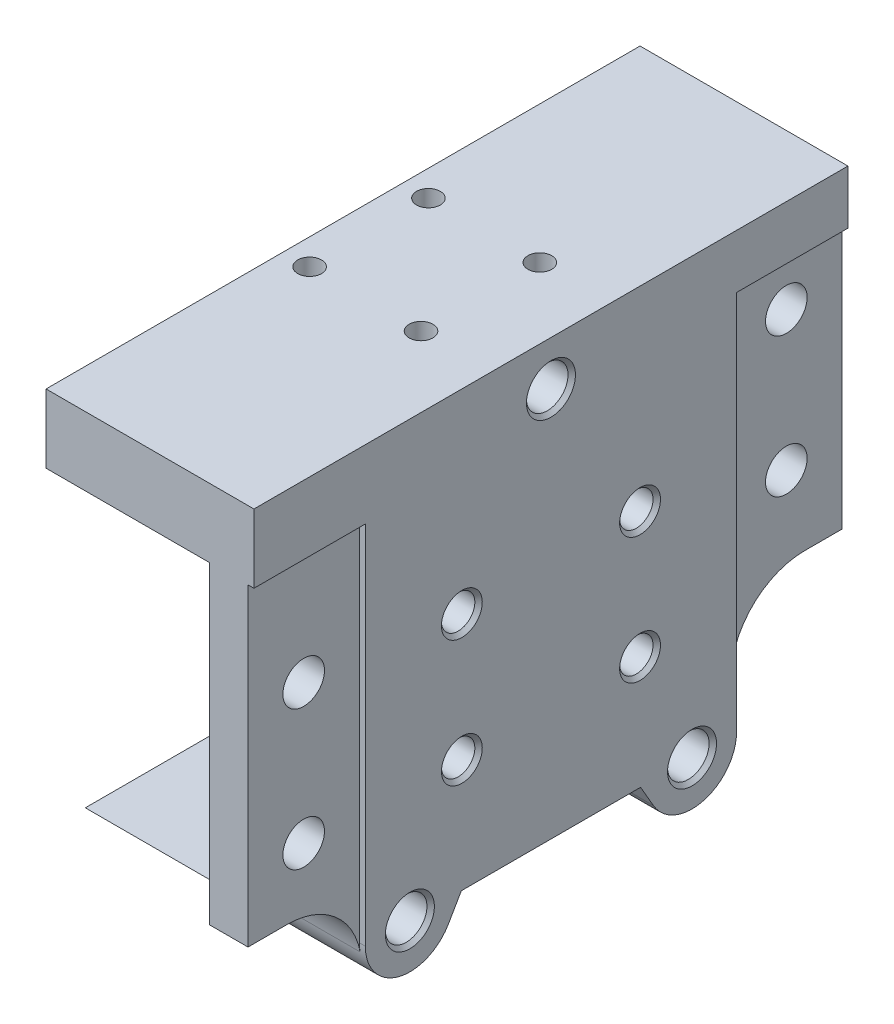
from build123d import *

# Parameters (mm, degrees)
BOSS_EXTRUDE1_DEPTH        = 50
F_3_2_3_2_DIAMETER_HOLE1_D = 3.2
SKETCH5_R                  = 2.25
CUT_EXTRUDE1_DEPTH         = 79.74007874
SKETCH6_W                  = 15
SKETCH6_H                  = 4.75
BOSS_EXTRUDE2_DEPTH        = 28
SKETCH8_W                  = 12.2
SKETCH8_H                  = 80
BOSS_EXTRUDE3_DEPTH        = 25
SKETCH9_R                  = 2.75
CUT_EXTRUDE2_DEPTH         = 105.770033884
BOSS_EXTRUDE4_REACH        = 108.066
CUT_EXTRUDE3_REACH         = 108.066
SKETCH11_R                 = 2.8
CHAMFER1_SIZE              = 0.5
CUT_EXTRUDE4_DEPTH         = 104.806358187
SKETCH14_W                 = 15
SKETCH14_H                 = 40
BOSS_EXTRUDE5_DEPTH        = 5.2
SKETCH16_W                 = 15
SKETCH16_H                 = 17
CUT_EXTRUDE6_DEPTH         = 92.821838361
SKETCH18_W                 = 15
SKETCH18_H                 = 35.5
BOSS_EXTRUDE6_DEPTH        = 5.2
SKETCH20_W                 = 7.799038106
SKETCH20_H                 = 4.25
BOSS_EXTRUDE7_DEPTH        = 27.2
FILLET1_R                  = 10
SKETCH22_R                 = 2.8
CUT_EXTRUDE8_DEPTH         = 92.581056993
SKETCH24_R                 = 2.8
CUT_EXTRUDE9_DEPTH         = 91.173443984
BOSS_EXTRUDE9_START        = -28
BOSS_EXTRUDE9_DEPTH        = 28
CUT_EXTRUDE11_START        = 10
SKETCH29_R                 = 3.75
SKETCH29_R_2               = 1.6
CUT_EXTRUDE11_DEPTH        = 10
SKETCH28_W                 = 15
SKETCH28_H                 = 2.25
BOSS_EXTRUDE10_DEPTH       = 5.2
SKETCH30_W                 = 7.799038106
SKETCH30_H                 = 4.5
BOSS_EXTRUDE11_DEPTH       = 28
SKETCH31_W                 = 15
SKETCH31_H                 = 7.25
BOSS_EXTRUDE12_DEPTH       = 28
BOSS_EXTRUDE14_DEPTH       = 28
SKETCH33_R                 = 1.6
CUT_EXTRUDE12_DEPTH        = 86.574528921


with BuildPart() as part:
    # Sketch1 → Boss-Extrude1 (new body)
    with BuildSketch(Plane.XY):
        Polygon((-11, 0), (17, 0), (17, 54), (-11, 54), (-11, 47), (11, 47), (11, 7), (-11, 7), align=None)
    extrude(amount=BOSS_EXTRUDE1_DEPTH)

    # Ø3.2 (3.2) Diameter Hole1 (through all)
    with Locations(Plane(origin=(0, 0, 0), x_dir=(-1, 0, 0), z_dir=(0, -1, 0))):
        with Locations((-7.5, -17), (7.5, -17), (7.5, -33), (-7.5, -33)):
            Hole(F_3_2_3_2_DIAMETER_HOLE1_D / 2)

    # Sketch5 → Cut-Extrude1 (cut, through all)
    with BuildSketch(Plane(origin=(17, 0, 0), x_dir=(0, 0, -1), z_dir=(1, 0, 0))):
        with Locations(Location((-37, 32.25, 0), (0, 0, 90))):
            Circle(SKETCH5_R)
        with Locations(Location((-13, 32.25, 0), (0, 0, 90))):
            Circle(SKETCH5_R)
        with Locations(Location((-37, 15.25, 0), (0, 0, 90))):
            Circle(SKETCH5_R)
        with Locations(Location((-13, 15.25, 0), (0, 0, 90))):
            Circle(SKETCH5_R)
    extrude(amount=-CUT_EXTRUDE1_DEPTH, mode=Mode.SUBTRACT)

    # Sketch6 → Boss-Extrude2 (add)
    with BuildSketch(Plane(origin=(17, 0, 0), x_dir=(0, 0, -1), z_dir=(1, 0, 0))):
        with Locations((-57.5, 51.625)):
            Rectangle(SKETCH6_W, SKETCH6_H)
        with Locations((7.5, 51.625)):
            Rectangle(SKETCH6_W, SKETCH6_H)
    extrude(amount=-BOSS_EXTRUDE2_DEPTH)

    # Sketch8 → Boss-Extrude3 (add)
    with BuildSketch(Plane(origin=(0, 54, 0), x_dir=(1, 0, 0), z_dir=(0, 1, 0))):
        with Locations((0.5, -25)):
            Rectangle(SKETCH8_W, SKETCH8_H)
    extrude(amount=BOSS_EXTRUDE3_DEPTH)

    # Sketch9 → Cut-Extrude2 (cut, through all)
    with BuildSketch(Plane.ZY.offset(5.6)):
        with Locations((-7.5, 66.2)):
            Circle(SKETCH9_R)
        with Locations((57.5, 66.2)):
            Circle(SKETCH9_R)
    extrude(amount=-CUT_EXTRUDE2_DEPTH, mode=Mode.SUBTRACT)

    # Boss-Extrude4: up to this face of the body (flat: up to its plane)
    boss_extrude4_end = Plane(part.part.faces().sort_by_distance((17, 28.337162775, 25))[0])
    # Sketch10 → Boss-Extrude4 (add, up to the picked face)
    with BuildSketch(Plane.ZY.offset(11), mode=Mode.PRIVATE) as boss_extrude4_sk1:
        with BuildLine():
            Line((11.196152423, -3), (12.92820323, 0))
            Line((12.92820323, 0), (0, 0))
            ThreePointArc((0, 0), (4.447085729, -5.795554958), (11.196152423, -3))
        make_face()
    boss_extrude4_tool1 = split(extrude(boss_extrude4_sk1.sketch, amount=-BOSS_EXTRUDE4_REACH, mode=Mode.PRIVATE), bisect_by=boss_extrude4_end, keep=Keep.BOTH, mode=Mode.PRIVATE)
    # Sketch10 → Boss-Extrude4 (add, up to the picked face)
    with BuildSketch(Plane.ZY.offset(11), mode=Mode.PRIVATE) as boss_extrude4_sk2:
        with BuildLine():
            Line((22, 57.696152423), (15.598076211, 54))
            Line((15.598076211, 54), (34.401923789, 54))
            Line((34.401923789, 54), (28, 57.696152423))
            ThreePointArc((28, 57.696152423), (25, 58.5), (22, 57.696152423))
        make_face()
    boss_extrude4_tool2 = split(extrude(boss_extrude4_sk2.sketch, amount=-BOSS_EXTRUDE4_REACH, mode=Mode.PRIVATE), bisect_by=boss_extrude4_end, keep=Keep.BOTH, mode=Mode.PRIVATE)
    # Sketch10 → Boss-Extrude4 (add, up to the picked face)
    with BuildSketch(Plane.ZY.offset(11), mode=Mode.PRIVATE) as boss_extrude4_sk3:
        with BuildLine():
            Line((38.803847577, -3), (37.07179677, 0))
            Line((37.07179677, 0), (50, 0))
            ThreePointArc((50, 0), (45.552914271, -5.795554958), (38.803847577, -3))
        make_face()
    boss_extrude4_tool3 = split(extrude(boss_extrude4_sk3.sketch, amount=-BOSS_EXTRUDE4_REACH, mode=Mode.PRIVATE), bisect_by=boss_extrude4_end, keep=Keep.BOTH, mode=Mode.PRIVATE)
    add(boss_extrude4_tool1.solids().sort_by(Axis((-11, -2.516615, 6.104318), (1, 0, 0)))[0])
    add(boss_extrude4_tool2.solids().sort_by(Axis((-11, 55.695428, 25), (1, 0, 0)))[0])
    add(boss_extrude4_tool3.solids().sort_by(Axis((-11, -2.516615, 43.895682), (1, 0, 0)))[0])

    # Sketch11 → Cut-Extrude3 (cut, up to next)
    with BuildSketch(Plane.ZY.offset(11), mode=Mode.PRIVATE) as cut_extrude3_sk1:
        with Locations(Location((25, 52.5, 0), (0, 0, 270))):
            Circle(SKETCH11_R)
    cut_extrude3_tool1 = extrude(cut_extrude3_sk1.sketch, amount=-CUT_EXTRUDE3_REACH, mode=Mode.PRIVATE) & part.part
    # Sketch11 → Cut-Extrude3 (cut, up to next)
    with BuildSketch(Plane.ZY.offset(11), mode=Mode.PRIVATE) as cut_extrude3_sk2:
        with Locations(Location((44, 0, 0), (0, 0, 270))):
            Circle(SKETCH11_R)
    cut_extrude3_tool2 = extrude(cut_extrude3_sk2.sketch, amount=-CUT_EXTRUDE3_REACH, mode=Mode.PRIVATE) & part.part
    # Sketch11 → Cut-Extrude3 (cut, up to next)
    with BuildSketch(Plane.ZY.offset(11), mode=Mode.PRIVATE) as cut_extrude3_sk3:
        with Locations(Location((6, 0, 0), (0, 0, 270))):
            Circle(SKETCH11_R)
    cut_extrude3_tool3 = extrude(cut_extrude3_sk3.sketch, amount=-CUT_EXTRUDE3_REACH, mode=Mode.PRIVATE) & part.part
    add(cut_extrude3_tool1.solids().sort_by_distance((-11, 52.5, 25))[0], mode=Mode.SUBTRACT)
    add(cut_extrude3_tool2.solids().sort_by_distance((-11, 0, 44))[0], mode=Mode.SUBTRACT)
    add(cut_extrude3_tool3.solids().sort_by_distance((-11, 0, 6))[0], mode=Mode.SUBTRACT)

    # Chamfer1
    chamfer1_edges = [part.edges().sort_by_distance(p)[0] for p in [
        (6.6, 66.2, -10.25),
        (-5.6, 66.2, -10.25),
        (6.6, 66.2, 54.75),
        (-5.6, 66.2, 54.75),
        (-11, 55.3, 25),
        (17, 55.3, 25),
        (-11, 2.8, 44),
        (17, 2.8, 44),
        (-11, 2.8, 6),
        (17, 2.8, 6),
        (11, 30, 13),
        (17, 30, 13),
        (11, 13, 37),
        (17, 13, 37),
        (11, 13, 13),
        (17, 13, 13),
        (11, 30, 37),
        (17, 30, 37),
    ]]
    chamfer(chamfer1_edges, length=CHAMFER1_SIZE)

    # Sketch12 → Cut-Extrude4 (cut, through all)
    with BuildSketch(Plane(origin=(6.6, 0, 0), x_dir=(0, 0, -1), z_dir=(1, 0, 0))):
        with BuildLine():
            Line((-65, 54), (-34.401923789, 54))
            Line((-34.401923789, 54), (-28, 57.696152423))
            ThreePointArc((-28, 57.696152423), (-25, 58.5), (-22, 57.696152423))
            Line((-22, 57.696152423), (-15.598076211, 54))
            Line((-15.598076211, 54), (15, 54))
            Line((15, 54), (15, 79))
            Line((15, 79), (-65, 79))
            Line((-65, 79), (-65, 54))
        make_face()
    extrude(amount=-CUT_EXTRUDE4_DEPTH, mode=Mode.SUBTRACT)

    # Sketch14 → Boss-Extrude5 (add)
    with BuildSketch(Plane.ZY.offset(-11)):
        with Locations((57.5, 27)):
            Rectangle(SKETCH14_W, SKETCH14_H)
    extrude(amount=-BOSS_EXTRUDE5_DEPTH)

    # Sketch16 → Cut-Extrude6 (cut, through all)
    with BuildSketch(Plane(origin=(17, 0, 0), x_dir=(0, 0, -1), z_dir=(1, 0, 0))):
        with Locations((7.5, 45.5)):
            Rectangle(SKETCH16_W, SKETCH16_H)
    extrude(amount=-CUT_EXTRUDE6_DEPTH, mode=Mode.SUBTRACT)

    # Sketch18 → Boss-Extrude6 (add)
    with BuildSketch(Plane.ZY.offset(-11)):
        with Locations((-7.5, 33.5)):
            Rectangle(SKETCH18_W, SKETCH18_H)
    extrude(amount=-BOSS_EXTRUDE6_DEPTH)

    # Sketch20 → Boss-Extrude7 (add)
    with BuildSketch(Plane.ZY.offset(11)):
        with Locations((3.899519053, 56.125)):
            Rectangle(SKETCH20_W, SKETCH20_H)
    extrude(amount=-BOSS_EXTRUDE7_DEPTH)

    # Fillet1
    # the kernel refuses this fillet: 10 mm, written as the material it adds along each edge
    with BuildSketch(Plane(origin=(-13.290584114, 7, 50), x_dir=(0, 0, 1), z_dir=(1, 0, 0))) as fillet1_piece_1_section:
        with BuildLine():
            CenterArc((9.716233646, 10), FILLET1_R, 190.806922875, 79.193077125)
            Line((-0.106412383, 8.125), (-1.088676986, 7.9375))
            ThreePointArc((-1.088676986, 7.9375), (-1, 7), (-1, 0))
            Line((-1, 0), (0, -1))
            Line((0, -1), (9.716233646, -1))
            Line((9.716233646, -1), (9.716233646, 0))
        make_face()
    fillet1_piece_1 = extrude(amount=29.490584114, mode=Mode.PRIVATE)
    fillet1_piece_1 = split(fillet1_piece_1, bisect_by=Plane(origin=(-11, 4.720928539, 53.329711705), z_dir=(1, 0, 0)), keep=Keep.TOP, mode=Mode.PRIVATE)
    fillet1_piece_1 = split(fillet1_piece_1, bisect_by=Plane(origin=(0, 7, 53.329711705), z_dir=(0, -1, 0)), keep=Keep.TOP, mode=Mode.PRIVATE)
    add(fillet1_piece_1)
    with BuildSketch(Plane(origin=(-14, 15.75, 0), x_dir=(0, 0, -1), z_dir=(1, 0, 0))) as fillet1_piece_2_section:
        with BuildLine():
            CenterArc((FILLET1_R, -FILLET1_R), FILLET1_R, 90, 90)
            Line((0, -FILLET1_R), (0, 0))
            Line((0, 0), (FILLET1_R, 0))
        make_face()
    fillet1_piece_2 = extrude(amount=30.2, mode=Mode.PRIVATE)
    fillet1_piece_2 = split(fillet1_piece_2, bisect_by=Plane(origin=(-11, 6.687745624, -0.023513871), z_dir=(1, 0, 0)), keep=Keep.TOP, mode=Mode.PRIVATE)
    fillet1_piece_2 = split(fillet1_piece_2, bisect_by=Plane(origin=(0, 7, -0.023513871), z_dir=(0, -1, 0)), keep=Keep.TOP, mode=Mode.PRIVATE)
    add(fillet1_piece_2)
    with BuildSketch(Plane(origin=(11, 15.75, 0), x_dir=(0, 0, -1), z_dir=(1, 0, 0))) as fillet1_piece_3:
        with BuildLine():
            CenterArc((FILLET1_R, -FILLET1_R), FILLET1_R, 90, 90)
            Line((0, -FILLET1_R), (0, 0))
            Line((0, 0), (FILLET1_R, 0))
        make_face()
    extrude(amount=5.2)

    # Sketch22 → Cut-Extrude8 (cut, through all)
    with BuildSketch(Plane(origin=(16.2, 0, 0), x_dir=(0, 0, -1), z_dir=(1, 0, 0))):
        with Locations((-57.5, 34.125)):
            Circle(SKETCH22_R)
        with Locations((-57.5, 15.375)):
            Circle(SKETCH22_R)
    extrude(amount=-CUT_EXTRUDE8_DEPTH, mode=Mode.SUBTRACT)

    # Sketch24 → Cut-Extrude9 (cut, through all)
    with BuildSketch(Plane.ZY.offset(-11)):
        with Locations((-7.5, 45.125)):
            Circle(SKETCH24_R)
        with Locations((-7.5, 26.375)):
            Circle(SKETCH24_R)
    extrude(amount=-CUT_EXTRUDE9_DEPTH, mode=Mode.SUBTRACT)

    # Sketch26 → Boss-Extrude9 (add)
    with BuildSketch(Plane(origin=(17, 0, 0), x_dir=(0, 0, -1), z_dir=(1, 0, 0)).offset(BOSS_EXTRUDE9_START)):
        with BuildLine():
            Line((-7.799038106, 58.5), (-25, 58.5))
            ThreePointArc((-25, 58.5), (-23.447085729, 58.295554958), (-22, 57.696152423))
            Line((-22, 57.696152423), (-15.598076211, 54))
            Line((-15.598076211, 54), (-7.799038106, 54))
            Line((-7.799038106, 54), (-7.799038106, 58.5))
        make_face()
    extrude(amount=BOSS_EXTRUDE9_DEPTH)

    # Sketch29 → Cut-Extrude11 (cut)
    with BuildSketch(Plane(origin=(0, 54, 0), x_dir=(1, 0, 0), z_dir=(0, 1, 0)).offset(CUT_EXTRUDE11_START)):
        with Locations((-7.5, -33)):
            Circle(SKETCH29_R)
        with Locations((7.5, -33)):
            Circle(SKETCH29_R)
        with Locations(Location((-7.5, -17, 0), (0, 0, 270))):
            Circle(SKETCH29_R_2)
        with Locations(Location((7.5, -17, 0), (0, 0, 270))):
            Circle(SKETCH29_R_2)
    extrude(amount=-CUT_EXTRUDE11_DEPTH, mode=Mode.SUBTRACT)

    # Sketch28 → Boss-Extrude10 (add)
    with BuildSketch(Plane(origin=(16.2, 0, 0), x_dir=(0, 0, -1), z_dir=(1, 0, 0))):
        with Locations((-57.5, 48.125)):
            Rectangle(SKETCH28_W, SKETCH28_H)
    extrude(amount=-BOSS_EXTRUDE10_DEPTH)

    # Sketch30 → Boss-Extrude11 (add)
    with BuildSketch(Plane(origin=(17, 0, 0), x_dir=(0, 0, -1), z_dir=(1, 0, 0))):
        with Locations((-3.899519053, 56.25)):
            Rectangle(SKETCH30_W, SKETCH30_H)
    extrude(amount=-BOSS_EXTRUDE11_DEPTH)

    # Sketch31 → Boss-Extrude12 (add)
    with BuildSketch(Plane(origin=(17, 0, 0), x_dir=(0, 0, -1), z_dir=(1, 0, 0))):
        with Locations((7.5, 54.875)):
            Rectangle(SKETCH31_W, SKETCH31_H)
    extrude(amount=-BOSS_EXTRUDE12_DEPTH)

    # Sketch32 → Boss-Extrude14 (add)
    with BuildSketch(Plane.ZY.offset(11)):
        with BuildLine():
            Line((25, 58.5), (25, 55.8))
            ThreePointArc((25, 55.8), (26.723368794, 55.314249456), (27.939387691, 54))
            Line((27.939387691, 54), (65, 54))
            Line((65, 54), (65, 58.5))
            Line((65, 58.5), (25, 58.5))
        make_face()
    extrude(amount=-BOSS_EXTRUDE14_DEPTH)

    # Sketch33 → Cut-Extrude12 (cut, through all)
    with BuildSketch(Plane.XZ.offset(-47)):
        with Locations(Location((-7.5, 33, 0), (0, 0, 270))):
            Circle(SKETCH33_R)
        with Locations(Location((7.5, 33, 0), (0, 0, 270))):
            Circle(SKETCH33_R)
    extrude(amount=-CUT_EXTRUDE12_DEPTH, mode=Mode.SUBTRACT)


solid = part.part
